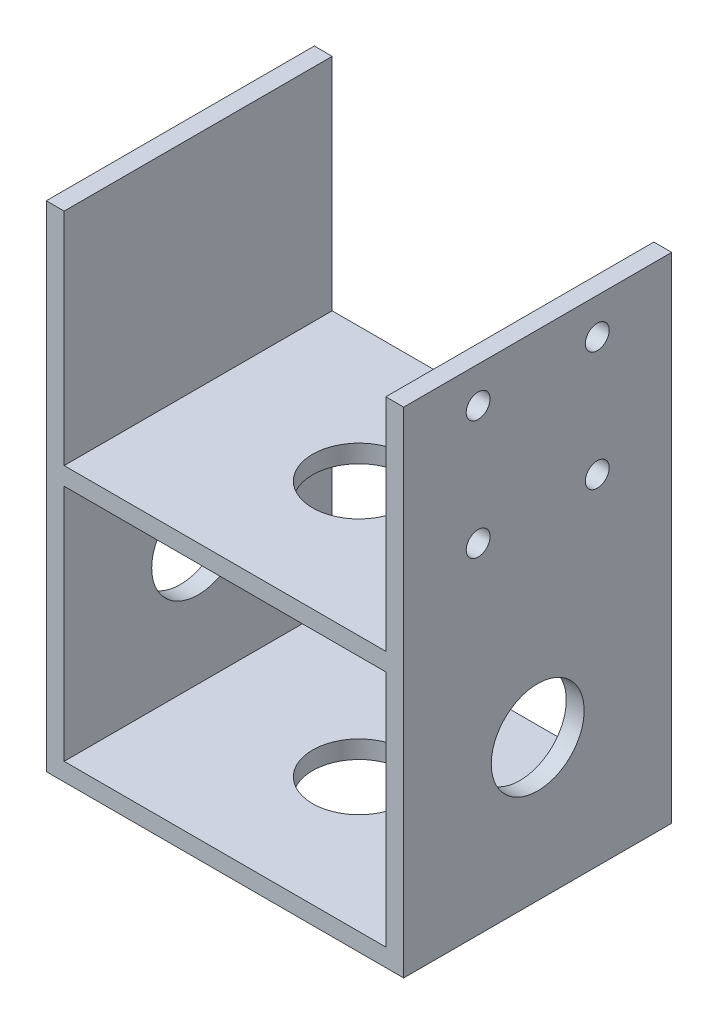
from build123d import *

# Parameters (mm, degrees)
SKETCH1_W           = 60
SKETCH1_H           = 45
BOSS_EXTRUDE1_DEPTH = 3
SKETCH5_W           = 3
SKETCH5_H           = 45
BOSS_EXTRUDE3_DEPTH = 35
SKETCH9_R           = 7.8
CUT_EXTRUDE5_DEPTH  = 10
SKETCH11_R          = 7.8
CUT_EXTRUDE8_DEPTH  = 75.5
SKETCH12_W          = 3
SKETCH12_H          = 45
BOSS_EXTRUDE4_DEPTH = 45
SKETCH13_R          = 2
CUT_EXTRUDE9_DEPTH  = 10


with BuildPart() as part:
    # Sketch1 → Boss-Extrude1 (new body)
    with BuildSketch(Plane(origin=(0, 0, 0), x_dir=(1, 0, 0), z_dir=(0, 1, 0))):
        Rectangle(SKETCH1_W, SKETCH1_H)
    boss_extrude1 = extrude(amount=BOSS_EXTRUDE1_DEPTH)

    # Sketch5 → Boss-Extrude3 (add)
    with BuildSketch(Plane(origin=(0, 3, 0), x_dir=(1, 0, 0), z_dir=(0, 1, 0))):
        with Locations((28.5, 0)):
            Rectangle(SKETCH5_W, SKETCH5_H)
        with Locations((-28.5, 0)):
            Rectangle(SKETCH5_W, SKETCH5_H)
    extrude(amount=BOSS_EXTRUDE3_DEPTH)

    # Sketch9 → Cut-Extrude5 (cut)
    with BuildSketch(Plane(origin=(0, 3, 0), x_dir=(1, 0, 0), z_dir=(0, 1, 0))):
        Circle(SKETCH9_R)
    cut_extrude5 = extrude(amount=-CUT_EXTRUDE5_DEPTH, mode=Mode.SUBTRACT)

    # Sketch11 → Cut-Extrude8 (cut, through all)
    with BuildSketch(Plane.ZY.offset(30)):
        with Locations((0, 23.75)):
            Circle(SKETCH11_R)
    extrude(amount=-CUT_EXTRUDE8_DEPTH, mode=Mode.SUBTRACT)

    # Sketch12 → Boss-Extrude4 (add)
    with BuildSketch(Plane(origin=(0, 38, 0), x_dir=(1, 0, 0), z_dir=(0, 1, 0))):
        with Locations((-28.5, 0)):
            Rectangle(SKETCH12_W, SKETCH12_H)
        with Locations((28.5, 0)):
            Rectangle(SKETCH12_W, SKETCH12_H)
    extrude(amount=BOSS_EXTRUDE4_DEPTH)

    # Sketch13 → Cut-Extrude9 (cut)
    with BuildSketch(Plane(origin=(30, 0, 0), x_dir=(0, 0, -1), z_dir=(1, 0, 0))):
        with Locations((-10, 76.955662999)):
            Circle(SKETCH13_R)
        with Locations((10, 76.955662999)):
            Circle(SKETCH13_R)
        with Locations((10, 56.955662999)):
            Circle(SKETCH13_R)
        with Locations((-10, 56.955662999)):
            Circle(SKETCH13_R)
    extrude(amount=-CUT_EXTRUDE9_DEPTH, mode=Mode.SUBTRACT)

    # Mirror1: Boss-Extrude1, Cut-Extrude5 across plane
    add(boss_extrude1.mirror(Plane.ZX.offset(23)))
    add(cut_extrude5.mirror(Plane.ZX.offset(23)), mode=Mode.SUBTRACT)


solid = part.part
